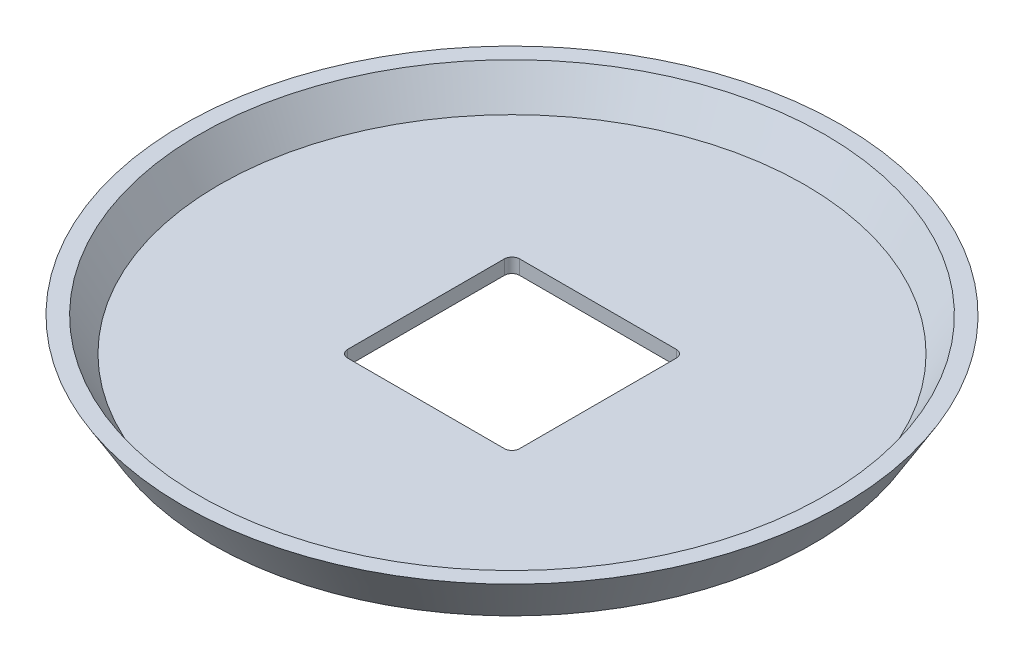
from build123d import *

# Parameters (mm, degrees)
SKETCH2_W          = 36
SKETCH2_H          = 36
CUT_EXTRUDE1_DEPTH = 98.831487774
FILLET1_R          = 1.6


with BuildPart() as part:
    # Sketch1 → Revolve1 (revolve)
    with BuildSketch(Plane.XY):
        Polygon((0, 0), (63, 0), (69, 10), (65.501428863, 10), (61.301428863, 3), (0, 3), align=None)
    revolve(axis=Axis((0, 0, 0), (0, 1, 0)))

    # Sketch2 → Cut-Extrude1 (cut, through all)
    with BuildSketch(Plane(origin=(0, 3, 0), x_dir=(1, 0, 0), z_dir=(0, 1, 0))):
        Rectangle(SKETCH2_W, SKETCH2_H)
    extrude(amount=-CUT_EXTRUDE1_DEPTH, mode=Mode.SUBTRACT)

    # Fillet1
    fillet1_edges = [part.edges().sort_by_distance(p)[0] for p in [
        (18, 1.5, -18),
        (18, 1.5, 18),
        (-18, 1.5, 18),
        (-18, 1.5, -18),
    ]]
    fillet(fillet1_edges, radius=FILLET1_R)


solid = part.part
